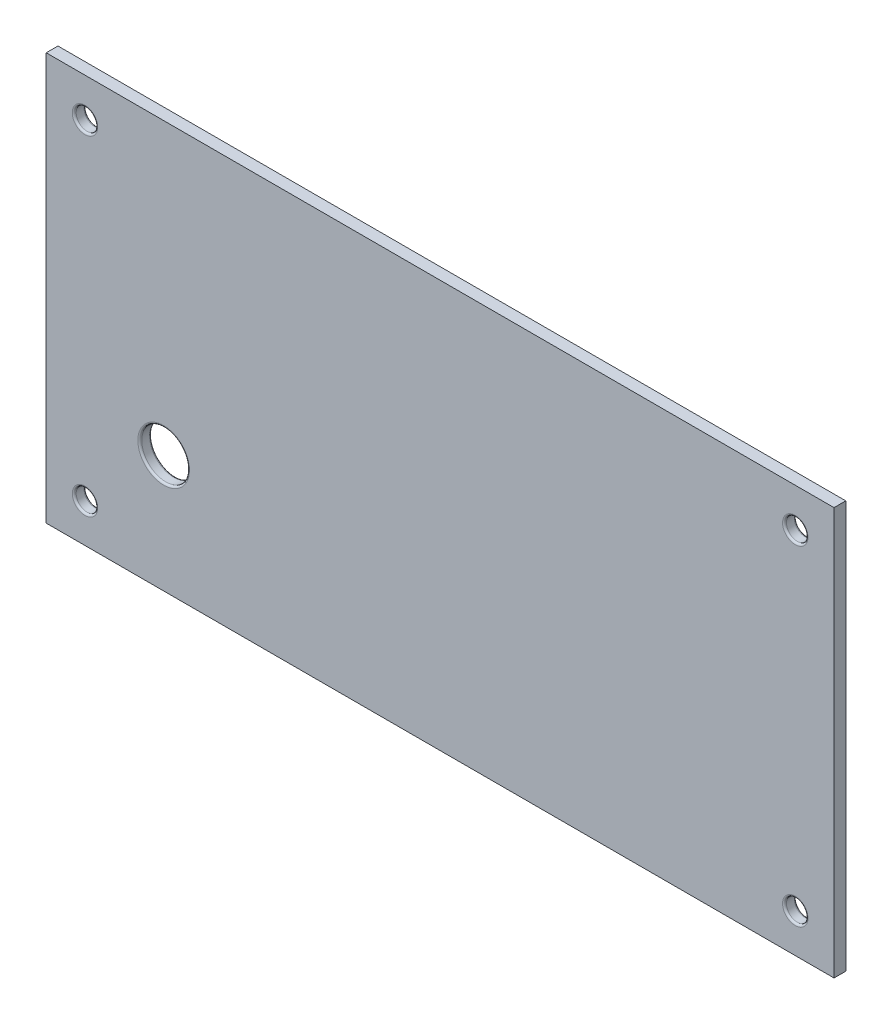
from build123d import *

# Parameters (mm, degrees)
SKETCH1_W           = 201.204
SKETCH1_H           = 104.04
BOSS_EXTRUDE1_DEPTH = 3
SKETCH3_R           = 2.75
CUT_EXTRUDE2_DEPTH  = 114.295378564
FILLET2_R           = 0.5
SKETCH4_R           = 6.1
CUT_EXTRUDE4_DEPTH  = 114.295378564
FILLET3_R           = 0.5


with BuildPart() as part:
    # Sketch1 → Boss-Extrude1 (new body)
    with BuildSketch(Plane.XY):
        Rectangle(SKETCH1_W, SKETCH1_H)
    extrude(amount=BOSS_EXTRUDE1_DEPTH)

    # Sketch3 → Cut-Extrude2 (cut, through all)
    with BuildSketch(Plane.XY.offset(3)):
        with Locations((-90.702, 42.12)):
            Circle(SKETCH3_R)
        with Locations((90.702, 42.12)):
            Circle(SKETCH3_R)
        with Locations((90.702, -42.12)):
            Circle(SKETCH3_R)
        with Locations((-90.702, -42.12)):
            Circle(SKETCH3_R)
    extrude(amount=-CUT_EXTRUDE2_DEPTH, mode=Mode.SUBTRACT)

    # Fillet2
    fillet2_edges = [part.edges().sort_by_distance(p)[0] for p in [
        (87.952, 42.12, 3),
        (87.952, 42.12, 0),
        (87.952, -42.12, 3),
        (87.952, -42.12, 0),
        (-93.452, -42.12, 3),
        (-93.452, -42.12, 0),
        (-93.452, 42.12, 3),
        (-93.452, 42.12, 0),
    ]]
    fillet(fillet2_edges, radius=FILLET2_R)

    # Sketch4 → Cut-Extrude4 (cut, through all)
    with BuildSketch(Plane.XY.offset(3)):
        with Locations((-70.602, -22.02)):
            Circle(SKETCH4_R)
    extrude(amount=-CUT_EXTRUDE4_DEPTH, mode=Mode.SUBTRACT)

    # Fillet3
    fillet3_edges = [part.edges().sort_by_distance(p)[0] for p in [
        (-76.702, -22.02, 3),
        (-76.702, -22.02, 0),
    ]]
    fillet(fillet3_edges, radius=FILLET3_R)


solid = part.part
